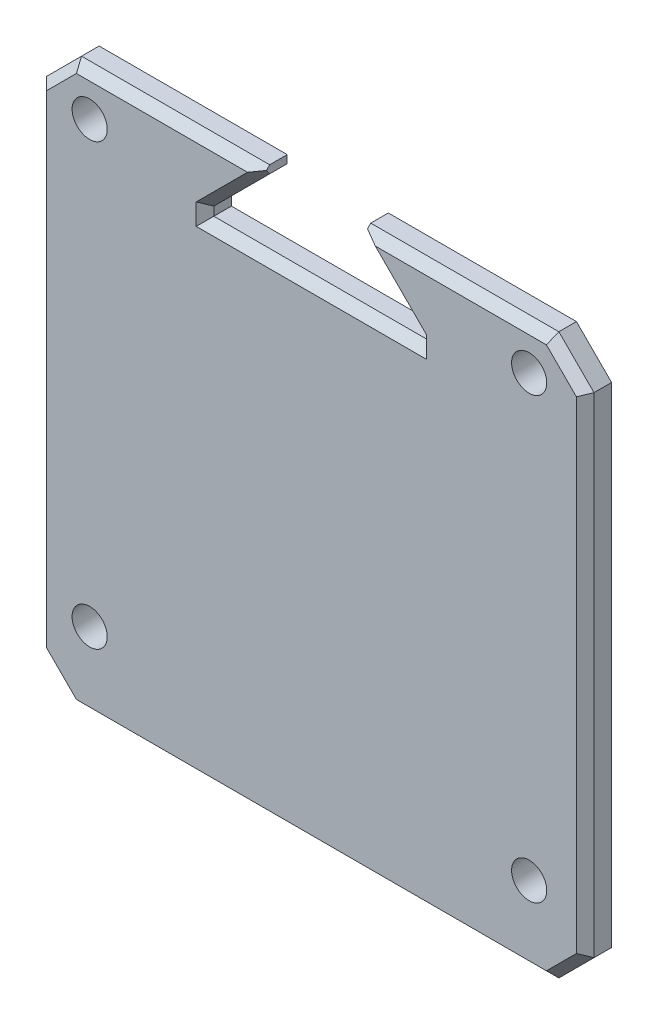
from build123d import *

# Parameters (mm, degrees)
BOSS_EXTRUDE1_DEPTH = 3
CUT_EXTRUDE4_DEPTH  = 10
CHAMFER1_SIZE       = 1
SKETCH4_R           = 2
CUT_EXTRUDE5_DEPTH  = 10


with BuildPart() as part:
    # Sketch3 → Boss-Extrude1 (new body)
    with BuildSketch(Plane.XY):
        Polygon((-26.921356186, 32.06604295), (27.378643814, 32.06604295), (31.378643814, 28.06604295), (31.378643814, -27.608755321), (27.378643814, -31.608755321), (-26.921356186, -31.608755321), (-30.921356186, -27.608755321), (-30.921356186, 28.06604295), align=None)
    extrude(amount=BOSS_EXTRUDE1_DEPTH)

    # Sketch2 → Cut-Extrude4 (cut)
    with BuildSketch(Plane.XY):
        Polygon((-5.521356186, 31.16959634), (-11.874909576, 24.81604295), (-11.874909576, 23.81604295), (12.332197205, 23.81604295), (12.332197205, 24.81604295), (5.978643814, 31.16959634), (5.978643814, 32.31604295), (-5.521356186, 32.31604295), align=None)
    extrude(amount=CUT_EXTRUDE4_DEPTH, mode=Mode.SUBTRACT)

    # Chamfer1
    chamfer1_edges = [part.edges().sort_by_distance(p)[0] for p in [
        (-16.221356186, 32.06604295, 3),
        (-28.921356186, 30.06604295, 3),
        (-30.921356186, 0.228643814, 3),
        (-28.921356186, -29.608755321, 3),
        (0.228643814, -31.608755321, 3),
        (29.378643814, -29.608755321, 3),
        (31.378643814, 0.228643814, 3),
        (29.378643814, 30.06604295, 3),
        (16.678643814, 32.06604295, 3),
    ]]
    chamfer(chamfer1_edges, length=CHAMFER1_SIZE)
    chamfer1_2_edges = [part.edges().sort_by_distance(p)[0] for p in [
        (9.207197205, 27.94104295, 3),
        (12.332197205, 24.31604295, 3),
        (0.228643814, 23.81604295, 3),
        (-11.874909576, 24.31604295, 3),
        (-8.749909576, 27.94104295, 3),
    ]]
    chamfer(chamfer1_2_edges, length=CHAMFER1_SIZE)

    # Sketch4 → Cut-Extrude5 (cut)
    with BuildSketch(Plane.XY.offset(3)):
        with Locations((-25, 27.31604295)):
            Circle(SKETCH4_R)
        with Locations((25, 27.31604295)):
            Circle(SKETCH4_R)
        with Locations((25, -22.68395705)):
            Circle(SKETCH4_R)
        with Locations((-25, -22.68395705)):
            Circle(SKETCH4_R)
    extrude(amount=-CUT_EXTRUDE5_DEPTH, mode=Mode.SUBTRACT)


solid = part.part
